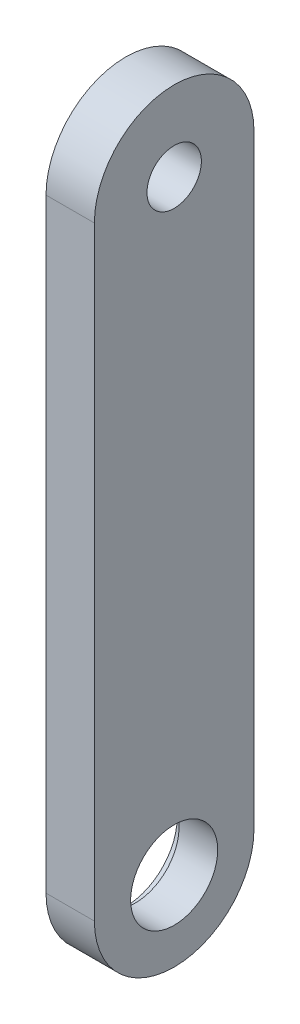
from build123d import *

# Parameters (mm, degrees)
SKETCH2_R           = 3.6
BOSS_EXTRUDE1_DEPTH = 2
SKETCH3_R           = 4.25
CUT_EXTRUDE1_DEPTH  = 0.8


with BuildPart() as part:
    # Sketch2 → Boss-Extrude1 (new, symmetric)
    with BuildSketch(Plane.YZ):
        with BuildLine():
            Line((50, 6.6), (0, 6.6))
            ThreePointArc((0, 6.6), (-6.6, 0), (0, -6.6))
            Line((0, -6.6), (50, -6.6))
            ThreePointArc((50, -6.6), (56.6, 0), (50, 6.6))
        make_face()
        Circle(SKETCH2_R, mode=Mode.SUBTRACT)
        with BuildLine():
            ThreePointArc((47.75, 0), (50, 2.25), (52.25, 0))
            ThreePointArc((52.25, 0), (50, -2.25), (47.75, 0))
        make_face(mode=Mode.SUBTRACT)
    extrude(amount=BOSS_EXTRUDE1_DEPTH, both=True)

    # Sketch3 → Cut-Extrude1 (cut)
    with BuildSketch(Plane.YZ.offset(-2)):
        Circle(SKETCH3_R)
    extrude(amount=CUT_EXTRUDE1_DEPTH, mode=Mode.SUBTRACT)


solid = part.part
